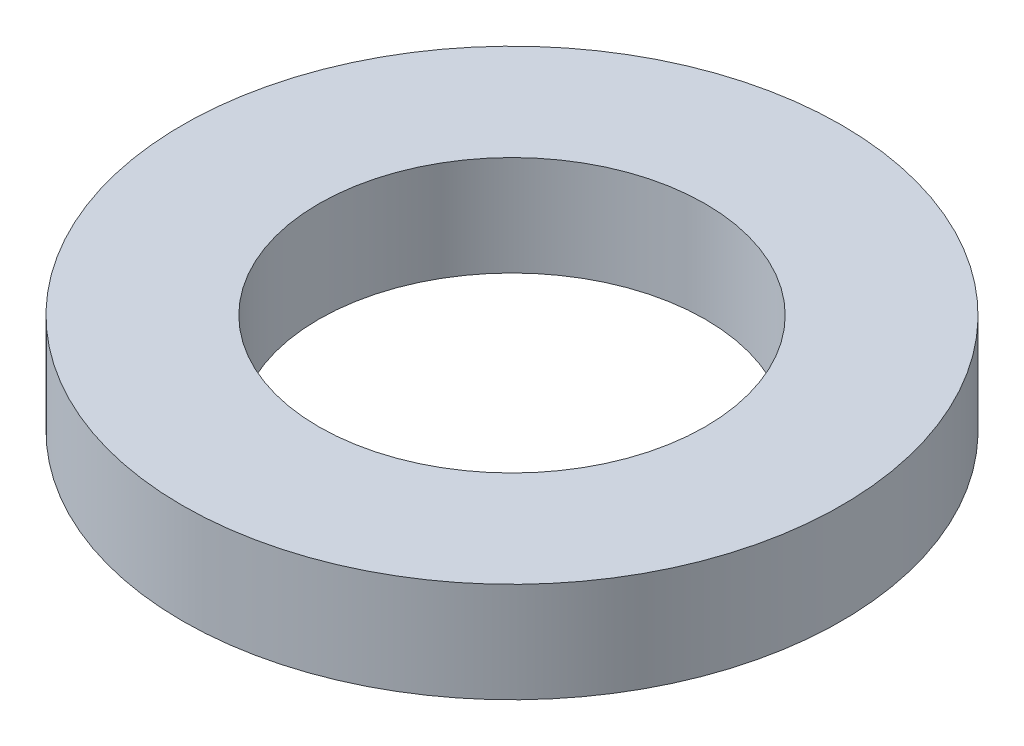
from build123d import *

# Parameters (mm, degrees)
SKETCH1_R           = 72.5
BOSS_EXTRUDE1_DEPTH = 22
SKETCH2_R           = 42.5
CUT_EXTRUDE1_DEPTH  = 105.864197894


with BuildPart() as part:
    # Sketch1 → Boss-Extrude1 (new body)
    with BuildSketch(Plane(origin=(0, 0, 0), x_dir=(1, 0, 0), z_dir=(0, 1, 0))):
        Circle(SKETCH1_R)
    extrude(amount=BOSS_EXTRUDE1_DEPTH)

    # Sketch2 → Cut-Extrude1 (cut, through all)
    with BuildSketch(Plane(origin=(0, 0, 0), x_dir=(1, 0, 0), z_dir=(0, 1, 0))):
        Circle(SKETCH2_R)
    extrude(amount=CUT_EXTRUDE1_DEPTH, mode=Mode.SUBTRACT)


solid = part.part
